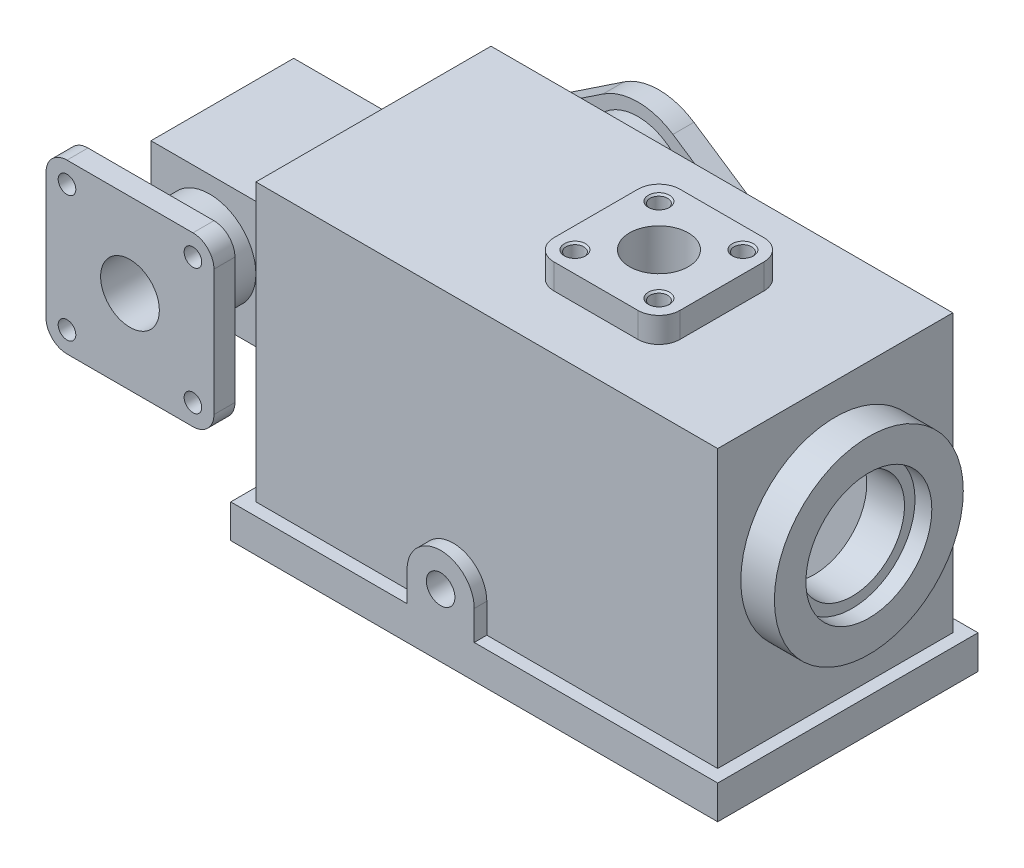
from build123d import *

# Parameters (mm, degrees)
SKETCH_1_W                                = 110
SKETCH_1_H                                = 56
EXTRUDE_1_DEPTH                           = 74
SKETCH_2_W                                = 36
SKETCH_2_H                                = 30
EXTRUDE_2_DEPTH                           = 17
SHELL_1_T                                 = -5
SKETCH_3_W                                = 116
SKETCH_3_H                                = 62
SKETCH_3_W_2                              = 110
SKETCH_3_H_2                              = 56
EXTRUDE_3_DEPTH                           = 8
EXTRUDE_4_DEPTH                           = 8
MIRROR_1_AT_THE_SECOND_PLANE_COPY_1_DEPTH = 8
HOLE_WIZARD_M5_1_D                        = 4.2
HOLE_WIZARD_M5_1_DEPTH                    = 8
HOLE_WIZARD_M5_1_CSINK_D                  = 5.05
HOLE_WIZARD_M5_1_CSINK_ANGLE              = 90
EXTRUDE_5_DEPTH                           = 6
HOLE_WIZARD_M5_2_D                        = 4.2
HOLE_WIZARD_M5_2_CSINK_D                  = 5.05
HOLE_WIZARD_M5_2_CSINK_ANGLE              = 90
CUT_EXTRUDE_1_REACH                       = 136.822
SKETCH_10_R                               = 7
SKETCH_29_W                               = 102
SKETCH_29_H                               = 44
CUT_EXTRUDE_8_DEPTH                       = 2
EXTRUDE_START                             = 26
SKETCH_11_R                               = 12
EXTRUDE_6_DEPTH                           = 20
EXTRUDE_7_DEPTH                           = 5
CUT_EXTRUDE_2_REACH                       = 154.135
SKETCH_13_R                               = 3
SKETCH_14_R                               = 9
CUT_EXTRUDE_3_DEPTH                       = 10
CUT_EXTRUDE_4_REACH                       = 149.326
SKETCH_15_R                               = 7
CHAMFER_1_SIZE                            = 2
EXTRUDE_8_REACH                           = 145.865
SKETCH_16_W                               = 22
SKETCH_16_H                               = 16
EXTRUDE_8_DIRECTION_2_REACH               = 145.865
SKETCH_17_R                               = 22.5
EXTRUDE_9_DEPTH                           = 8
SKETCH_18_R                               = 15
CUT_EXTRUDE_5_DEPTH                       = 4
CUT_EXTRUDE_6_REACH                       = 178.114
SKETCH_19_R                               = 12.5
EXTRUDE_10_DEPTH                          = 3
HOLE_WIZARD_M8_1_D                        = 6.8
HOLE_WIZARD_M8_1_DEPTH                    = 8
EXTRUDE_START_2                           = 17
SKETCH_23_R                               = 11
EXTRUDE_11_DEPTH                          = 19
EXTRUDE_12_DEPTH                          = 5
HOLE_START                                = 31
HOLE_WIZARD_M5_3_OUTLINE_R                = 2.1
HOLE_WIZARD_M5_3_DEPTH                    = 5
CUT_EXTRUDE_7_REACH                       = 160.821
SKETCH_27_R                               = 7
RIB_1_REACH                               = 145.583
SKETCH_30_WALL_W                          = 328.280671964
SKETCH_30_WALL_H                          = 5


# Read off the part's stored shape, not the designer's step: M5 螺纹孔3
with BuildPart() as part:
    # 草图1 → 凸台-拉伸1 (new body)
    with BuildSketch(Plane(origin=(0, 0, 0), x_dir=(1, 0, 0), z_dir=(0, 1, 0))):
        with Locations((-13, 0)):
            Rectangle(SKETCH_1_W, SKETCH_1_H)
    extrude(amount=EXTRUDE_1_DEPTH)

    # 草图2 → 凸台-拉伸2 (add, symmetric)
    with BuildSketch(Plane.XY):
        with Locations((-86, 44)):
            Rectangle(SKETCH_2_W, SKETCH_2_H)
    extrude(amount=EXTRUDE_2_DEPTH, both=True)

    # 抽壳1
    shell_1_openings = [part.faces().sort_by_distance(p)[0] for p in [
        (-13, 0, 0),
    ]]
    offset(amount=SHELL_1_T, openings=shell_1_openings, kind=Kind.INTERSECTION)

    # 草图3 → 凸台-拉伸3 (add)
    with BuildSketch(Plane.XZ):
        with Locations((-13, 0)):
            Rectangle(SKETCH_3_W, SKETCH_3_H)
        with Locations((-13, 0)):
            Rectangle(SKETCH_3_W_2, SKETCH_3_H_2, mode=Mode.SUBTRACT)
    extrude(amount=-EXTRUDE_3_DEPTH)

    # 草图4 → 凸台-拉伸4 (add)
    with BuildSketch(Plane.XZ):
        with BuildLine():
            Line((-63, 23), (-48.5, 23))
            Line((-48.5, 23), (-48.5, 17))
            ThreePointArc((-48.5, 17), (-50.257359313, 12.757359313), (-54.5, 11))
            Line((-54.5, 11), (-63, 11))
            Line((-63, 11), (-63, 23))
        make_face()
    extrude_4 = extrude(amount=-EXTRUDE_4_DEPTH)

    # 镜向1: 凸台-拉伸4 across plane
    add(extrude_4.mirror(Plane.ZY.offset(13)))

    # 镜向1 at the second plane: 凸台-拉伸4 across plane
    add(extrude_4.mirror(Plane.XY))

    # 镜向1 at the second plane copy 1 sket → 镜向1 at the second plane copy 1 (add)
    with BuildSketch(Plane(origin=(-26, 0, 0), x_dir=(-1, 0, 0), z_dir=(0, -1, 0))):
        with BuildLine():
            Line((-63, 23), (-48.5, 23))
            Line((-48.5, 23), (-48.5, 17))
            ThreePointArc((-48.5, 17), (-50.257359313, 12.757359313), (-54.5, 11))
            Line((-54.5, 11), (-63, 11))
            Line((-63, 11), (-63, 23))
        make_face()
    extrude(amount=-MIRROR_1_AT_THE_SECOND_PLANE_COPY_1_DEPTH)

    # M5 螺纹孔1
    with Locations(Plane.XZ):
        with Locations((28.5, 17), (-54.5, 17), (-54.5, -17), (28.5, -17)):
            CounterSinkHole(HOLE_WIZARD_M5_1_D / 2, HOLE_WIZARD_M5_1_CSINK_D / 2, depth=HOLE_WIZARD_M5_1_DEPTH, counter_sink_angle=HOLE_WIZARD_M5_1_CSINK_ANGLE)

    # 草图7 → 凸台-拉伸5 (add)
    with BuildSketch(Plane(origin=(0, 74, 0), x_dir=(1, 0, 0), z_dir=(0, 1, 0))):
        with BuildLine():
            Line((-10, -15), (10, -15))
            ThreePointArc((10, -15), (13.535533906, -13.535533906), (15, -10))
            Line((15, -10), (15, 10))
            ThreePointArc((15, 10), (13.535533906, 13.535533906), (10, 15))
            Line((10, 15), (-10, 15))
            ThreePointArc((-10, 15), (-13.535533906, 13.535533906), (-15, 10))
            Line((-15, 10), (-15, -10))
            ThreePointArc((-15, -10), (-13.535533906, -13.535533906), (-10, -15))
        make_face()
    extrude(amount=EXTRUDE_5_DEPTH)

    # M5 螺纹孔2 (through all)
    with Locations(Plane(origin=(0, 80, 0), x_dir=(1, 0, 0), z_dir=(0, 1, 0))):
        with Locations((10, 10), (-10, 10), (-10, -10), (10, -10)):
            CounterSinkHole(HOLE_WIZARD_M5_2_D / 2, HOLE_WIZARD_M5_2_CSINK_D / 2, counter_sink_angle=HOLE_WIZARD_M5_2_CSINK_ANGLE)

    # 草图10 → 切除-拉伸1 (cut, up to next)
    with BuildSketch(Plane(origin=(0, 80, 0), x_dir=(1, 0, 0), z_dir=(0, 1, 0)), mode=Mode.PRIVATE) as cut_extrude_1_sk1:
        with Locations(Location((0, 0, 0), (0, 0, 270))):
            Circle(SKETCH_10_R)
    cut_extrude_1_tool1 = extrude(cut_extrude_1_sk1.sketch, amount=-CUT_EXTRUDE_1_REACH, mode=Mode.PRIVATE) & part.part
    add(cut_extrude_1_tool1.solids().sort_by_distance((0, 80, 0))[0], mode=Mode.SUBTRACT)

    # 草图29 → 切除-拉伸8 (cut)
    with BuildSketch(Plane(origin=(0, 0, -28), x_dir=(-1, 0, 0), z_dir=(0, 0, -1))):
        with Locations((17, 30)):
            Rectangle(SKETCH_29_W, SKETCH_29_H)
    extrude(amount=-CUT_EXTRUDE_8_DEPTH, mode=Mode.SUBTRACT)

    # 草图11 → 凸台-拉伸6 (add)
    with BuildSketch(Plane(origin=(0, 0, 0), x_dir=(-1, 0, 0), z_dir=(0, 0, -1)).offset(EXTRUDE_START)):
        with Locations((46, 52)):
            Circle(SKETCH_11_R)
    extrude(amount=EXTRUDE_6_DEPTH)

    # 草图12 → 凸台-拉伸7 (add)
    with BuildSketch(Plane(origin=(0, 0, -46), x_dir=(-1, 0, 0), z_dir=(0, 0, -1))):
        with BuildLine():
            Line((54.333333333, 64.472191289), (66.777777778, 56.157397096))
            ThreePointArc((66.777777778, 56.157397096), (69, 52), (66.777777778, 47.842602904))
            Line((66.777777778, 47.842602904), (54.333333333, 39.527808711))
            ThreePointArc((54.333333333, 39.527808711), (46, 37), (37.666666667, 39.527808711))
            Line((37.666666667, 39.527808711), (25.222222222, 47.842602904))
            ThreePointArc((25.222222222, 47.842602904), (23, 52), (25.222222222, 56.157397096))
            Line((25.222222222, 56.157397096), (37.666666667, 64.472191289))
            ThreePointArc((37.666666667, 64.472191289), (46, 67), (54.333333333, 64.472191289))
        make_face()
    extrude(amount=-EXTRUDE_7_DEPTH)

    # 草图13 → 切除-拉伸2 (cut, up to next)
    with BuildSketch(Plane(origin=(0, 0, -46), x_dir=(-1, 0, 0), z_dir=(0, 0, -1)), mode=Mode.PRIVATE) as cut_extrude_2_sk1:
        with Locations((28, 52)):
            Circle(SKETCH_13_R)
    cut_extrude_2_tool1 = extrude(cut_extrude_2_sk1.sketch, amount=-CUT_EXTRUDE_2_REACH, mode=Mode.PRIVATE) & part.part
    # 草图13 → 切除-拉伸2 (cut, up to next)
    with BuildSketch(Plane(origin=(0, 0, -46), x_dir=(-1, 0, 0), z_dir=(0, 0, -1)), mode=Mode.PRIVATE) as cut_extrude_2_sk2:
        with Locations((64, 52)):
            Circle(SKETCH_13_R)
    cut_extrude_2_tool2 = extrude(cut_extrude_2_sk2.sketch, amount=-CUT_EXTRUDE_2_REACH, mode=Mode.PRIVATE) & part.part
    add(cut_extrude_2_tool1.solids().sort_by_distance((-28, 52, -46))[0], mode=Mode.SUBTRACT)
    add(cut_extrude_2_tool2.solids().sort_by_distance((-64, 52, -46))[0], mode=Mode.SUBTRACT)

    # 草图14 → 切除-拉伸3 (cut)
    with BuildSketch(Plane(origin=(0, 0, -46), x_dir=(-1, 0, 0), z_dir=(0, 0, -1))):
        with Locations((46, 52)):
            Circle(SKETCH_14_R)
    extrude(amount=-CUT_EXTRUDE_3_DEPTH, mode=Mode.SUBTRACT)

    # 草图15 → 切除-拉伸4 (cut, up to next)
    with BuildSketch(Plane(origin=(0, 0, -36), x_dir=(-1, 0, 0), z_dir=(0, 0, -1)), mode=Mode.PRIVATE) as cut_extrude_4_sk1:
        with Locations((46, 52)):
            Circle(SKETCH_15_R)
    cut_extrude_4_tool1 = extrude(cut_extrude_4_sk1.sketch, amount=-CUT_EXTRUDE_4_REACH, mode=Mode.PRIVATE) & part.part
    add(cut_extrude_4_tool1.solids().sort_by_distance((-46, 52, -36))[0], mode=Mode.SUBTRACT)

    # 倒角1
    chamfer_1_edges = [part.edges().sort_by_distance(p)[0] for p in [
        (-39, 52, -36),
    ]]
    chamfer(chamfer_1_edges, length=CHAMFER_1_SIZE - 0.0001)  # a hair under: the kernel refuses the full size

    # 凸台-拉伸8: up to this face of the body (flat: up to its plane)
    extrude_8_end = Plane(part.part.faces().sort_by_distance((-13, 4, -31))[0])
    # 草图16 → 凸台-拉伸8 (add, up to the picked face)
    with BuildSketch(Plane(origin=(0, 0, -28), x_dir=(-1, 0, 0), z_dir=(0, 0, -1)), mode=Mode.PRIVATE) as extrude_8_sk1:
        with Locations((0, 52)):
            Rectangle(SKETCH_16_W, SKETCH_16_H)
    extrude_8_tool1 = split(extrude(extrude_8_sk1.sketch, amount=EXTRUDE_8_REACH, mode=Mode.PRIVATE), bisect_by=extrude_8_end, keep=Keep.BOTH, mode=Mode.PRIVATE)
    add(extrude_8_tool1.solids().sort_by(Axis((0, 52, -28), (0, 0, -1)))[0])

    # 草图16 → 凸台-拉伸8 direction 2 (add, up to next)
    with BuildSketch(Plane(origin=(0, 0, -28), x_dir=(-1, 0, 0), z_dir=(0, 0, -1)), mode=Mode.PRIVATE) as extrude_8_direction_2_sk1:
        with Locations((0, 52)):
            Rectangle(SKETCH_16_W, SKETCH_16_H)
    extrude_8_direction_2_tool1 = extrude(extrude_8_direction_2_sk1.sketch, amount=-EXTRUDE_8_DIRECTION_2_REACH, mode=Mode.PRIVATE) - part.part
    add(extrude_8_direction_2_tool1.solids().sort_by_distance((0, 52, -28))[0])

    # 草图17 → 凸台-拉伸9 (add)
    with BuildSketch(Plane(origin=(42, 0, 0), x_dir=(0, 0, -1), z_dir=(1, 0, 0))):
        with Locations(Location((0, 44, 0), (0, 0, 180))):
            Circle(SKETCH_17_R)
    extrude(amount=EXTRUDE_9_DEPTH)

    # 草图18 → 切除-拉伸5 (cut)
    with BuildSketch(Plane(origin=(50, 0, 0), x_dir=(0, 0, -1), z_dir=(1, 0, 0))):
        with Locations((0, 44)):
            Circle(SKETCH_18_R)
    extrude(amount=-CUT_EXTRUDE_5_DEPTH, mode=Mode.SUBTRACT)

    # 草图19 → 切除-拉伸6 (cut, up to next)
    with BuildSketch(Plane(origin=(46, 0, 0), x_dir=(0, 0, -1), z_dir=(1, 0, 0)), mode=Mode.PRIVATE) as cut_extrude_6_sk1:
        with Locations((0, 44)):
            Circle(SKETCH_19_R)
    cut_extrude_6_tool1 = extrude(cut_extrude_6_sk1.sketch, amount=-CUT_EXTRUDE_6_REACH, mode=Mode.PRIVATE) & part.part
    add(cut_extrude_6_tool1.solids().sort_by_distance((46, 44, 0))[0], mode=Mode.SUBTRACT)

    # 草图20 → 凸台-拉伸10 (add)
    with BuildSketch(Plane.XY.offset(31)):
        with BuildLine():
            Line((-29, 8), (-29, 15))
            ThreePointArc((-29, 15), (-21, 23), (-13, 15))
            Line((-13, 15), (-13, 8))
            ThreePointArc((-13, 8), (-21, 0), (-29, 8))
        make_face()
    extrude(amount=-EXTRUDE_10_DEPTH)

    # M8 螺纹孔1
    with Locations(Plane.XY.offset(31)):
        with Locations((-21, 15)):
            Hole(HOLE_WIZARD_M8_1_D / 2, depth=HOLE_WIZARD_M8_1_DEPTH)

    # 草图23 → 凸台-拉伸11 (add)
    with BuildSketch(Plane.XY.offset(EXTRUDE_START_2)):
        with Locations((-90, 44)):
            Circle(SKETCH_23_R)
    extrude(amount=EXTRUDE_11_DEPTH)

    # 草图24 → 凸台-拉伸12 (add)
    with BuildSketch(Plane.XY.offset(36)):
        with BuildLine():
            Line((-105, 24), (-75, 24))
            ThreePointArc((-75, 24), (-71.464466094, 25.464466094), (-70, 29))
            Line((-70, 29), (-70, 59))
            ThreePointArc((-70, 59), (-71.464466094, 62.535533906), (-75, 64))
            Line((-75, 64), (-105, 64))
            ThreePointArc((-105, 64), (-108.535533906, 62.535533906), (-110, 59))
            Line((-110, 59), (-110, 29))
            ThreePointArc((-110, 29), (-108.535533906, 25.464466094), (-105, 24))
        make_face()
    extrude(amount=-EXTRUDE_12_DEPTH)

    # M5 螺纹孔3 outline → M5 螺纹孔3 (cut)
    with BuildSketch(Plane.XY.offset(HOLE_START)):
        with Locations((-75, 59)):
            Circle(HOLE_WIZARD_M5_3_OUTLINE_R)
        with Locations((-75, 29)):
            Circle(HOLE_WIZARD_M5_3_OUTLINE_R)
        with Locations((-105, 29)):
            Circle(HOLE_WIZARD_M5_3_OUTLINE_R)
        with Locations((-105, 59)):
            Circle(HOLE_WIZARD_M5_3_OUTLINE_R)
    extrude(amount=HOLE_WIZARD_M5_3_DEPTH, mode=Mode.SUBTRACT)

    # 草图27 → 切除-拉伸7 (cut, up to next)
    with BuildSketch(Plane.XY.offset(36), mode=Mode.PRIVATE) as cut_extrude_7_sk1:
        with Locations((-90, 44)):
            Circle(SKETCH_27_R)
    cut_extrude_7_tool1 = extrude(cut_extrude_7_sk1.sketch, amount=-CUT_EXTRUDE_7_REACH, mode=Mode.PRIVATE) & part.part
    add(cut_extrude_7_tool1.solids().sort_by_distance((-90, 44, 36))[0], mode=Mode.SUBTRACT)

    # 草图30 wall → 筋1 (add, up to next)
    with BuildSketch(Plane(origin=(-87.5, 18.5, 0), x_dir=(0.843661487732, -0.536875492193, 0), z_dir=(0.536875492193, 0.843661487732, 0)), mode=Mode.PRIVATE) as rib_1_sk1:
        Rectangle(SKETCH_30_WALL_W, SKETCH_30_WALL_H)
    rib_1_tool1 = extrude(rib_1_sk1.sketch, amount=RIB_1_REACH, mode=Mode.PRIVATE) - part.part
    add(rib_1_tool1.solids().sort_by_distance((-87.5, 18.5, 0))[0])


solid = part.part
